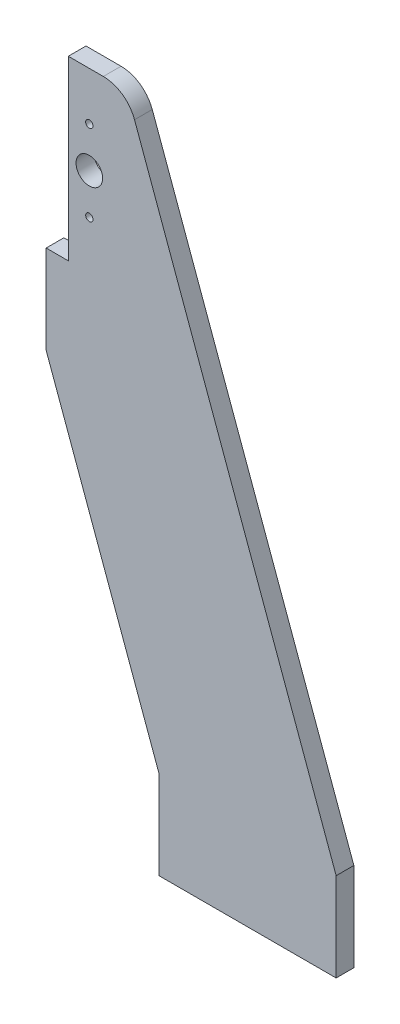
from build123d import *

# Parameters (mm, degrees)
SALIENTE_EXTRUIR1_DEPTH                        = 8
CROQUIS2_R                                     = 6
CORTAR_EXTRUIR1_DEPTH                          = 311.586541885
PERFORADOR_PARA_ROSCAR_PARA_MACHO_DE_ROS_D     = 3.3
PERFORADOR_PARA_ROSCAR_PARA_MACHO_DE_ROS_DEPTH = 10
PERFORADOR_PARA_ROSCAR_PARA_MACHO_DE_ROS_TIP   = 0.991420021
TALADROS_DE_ESPIGA_DE_4_0MM2_D                 = 4
TALADROS_DE_ESPIGA_DE_4_0MM2_DEPTH             = 10
TALADROS_DE_ESPIGA_DE_4_0MM2_TIP               = 1.201721238
PERFORADOR_PARA_ROSCAR_PARA_MACHO_DE_2_D       = 3.3
PERFORADOR_PARA_ROSCAR_PARA_MACHO_DE_2_DEPTH   = 7
PERFORADOR_PARA_ROSCAR_PARA_MACHO_DE_2_TIP     = 0.991420021


with BuildPart() as part:
    # Croquis1 → Saliente-Extruir1 (new body)
    with BuildSketch(Plane.XY):
        with BuildLine():
            Line((80, 0), (80, 40))
            Line((80, 40), (-11.039984671, 290.13030215))
            ThreePointArc((-11.039984671, 290.13030215), (-16.531727437, 297.287280664), (-25.135373982, 300))
            Line((-25.135373982, 300), (-40.955832797, 300))
            Line((-40.955832797, 300), (-40.955832797, 220))
            Line((-40.955832797, 220), (-50.955832797, 220))
            Line((-50.955832797, 220), (-50.955832797, 180))
            Line((-50.955832797, 180), (0, 40))
            Line((0, 40), (0, 0))
            Line((0, 0), (80, 0))
        make_face()
    extrude(amount=SALIENTE_EXTRUIR1_DEPTH)

    # Croquis2 → Cortar-Extruir1 (cut, through all)
    with BuildSketch(Plane(origin=(0, 0, 0), x_dir=(-1, 0, 0), z_dir=(0, 0, -1))):
        with Locations((31.455832797, 260)):
            Circle(CROQUIS2_R)
    extrude(amount=-CORTAR_EXTRUIR1_DEPTH, mode=Mode.SUBTRACT)

    # Perforador para roscar para macho de ros
    with Locations(Plane.ZY.offset(40.955832797)):
        with Locations((3, 288), (3, 232)):
            Hole(PERFORADOR_PARA_ROSCAR_PARA_MACHO_DE_ROS_D / 2, depth=PERFORADOR_PARA_ROSCAR_PARA_MACHO_DE_ROS_DEPTH)
            with Locations((0, 0, -(PERFORADOR_PARA_ROSCAR_PARA_MACHO_DE_ROS_DEPTH + PERFORADOR_PARA_ROSCAR_PARA_MACHO_DE_ROS_TIP / 2))):  # 118° drill point
                Cone(0, PERFORADOR_PARA_ROSCAR_PARA_MACHO_DE_ROS_D / 2, PERFORADOR_PARA_ROSCAR_PARA_MACHO_DE_ROS_TIP, mode=Mode.SUBTRACT)

    # Taladros de espiga de Ø4.0mm2
    with Locations(Plane.ZY.offset(40.955832797)):
        with Locations((4, 246), (4, 274)):
            Hole(TALADROS_DE_ESPIGA_DE_4_0MM2_D / 2, depth=TALADROS_DE_ESPIGA_DE_4_0MM2_DEPTH)
            with Locations((0, 0, -(TALADROS_DE_ESPIGA_DE_4_0MM2_DEPTH + TALADROS_DE_ESPIGA_DE_4_0MM2_TIP / 2))):  # 118° drill point
                Cone(0, TALADROS_DE_ESPIGA_DE_4_0MM2_D / 2, TALADROS_DE_ESPIGA_DE_4_0MM2_TIP, mode=Mode.SUBTRACT)

    # Perforador para roscar para macho de 2
    with Locations(Plane.XY.offset(8)):
        with Locations((-31.455832797, 278.25), (-31.455832797, 241.75)):
            Hole(PERFORADOR_PARA_ROSCAR_PARA_MACHO_DE_2_D / 2, depth=PERFORADOR_PARA_ROSCAR_PARA_MACHO_DE_2_DEPTH)
            with Locations((0, 0, -(PERFORADOR_PARA_ROSCAR_PARA_MACHO_DE_2_DEPTH + PERFORADOR_PARA_ROSCAR_PARA_MACHO_DE_2_TIP / 2))):  # 118° drill point
                Cone(0, PERFORADOR_PARA_ROSCAR_PARA_MACHO_DE_2_D / 2, PERFORADOR_PARA_ROSCAR_PARA_MACHO_DE_2_TIP, mode=Mode.SUBTRACT)


solid = part.part
